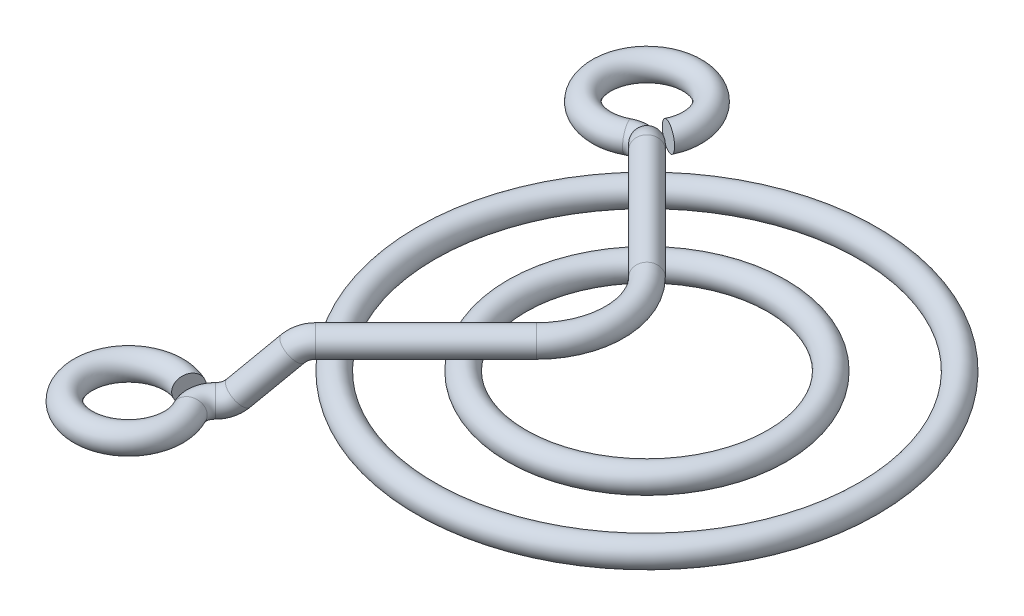
from build123d import *

# Parameters (mm, degrees)
SKETCH1_R               = 0.8
SKETCH3_R               = 0.8
SKETCH5_R               = 0.8
SKETCH7_R               = 0.8
CUT_EXTRUDE1_DEPTH      = 29.131121712
CUT_EXTRUDE1_DEPTH_BACK = 29.131121712
CIRPATTERN1_COUNT       = 2
CIRPATTERN1_ANGLE       = 90
SKETCH10_R              = 0.8


with BuildPart() as part:
    # Sketch1 → Revolve1 (revolve)
    with BuildSketch(Plane.XY):
        with Locations((-8.025, 2.4)):
            Circle(SKETCH1_R)
        with Locations((-13.65, 2.4)):
            Circle(SKETCH1_R)
    revolve(axis=Axis((0, 2.4, 0), (0, -1, 0)))


with BuildPart() as body_2:
    # Sweep1: sweep along a path in Sketch2
    with BuildLine(Plane(origin=(0, 0, 0), x_dir=(1, 0, 0), z_dir=(0, 1, 0))) as sweep1_path:
        Line((-10.224764056, 10.224764056), (-3.414213562, 3.414213562))
        ThreePointArc((-3.414213562, 3.414213562), (-2.36754213, 1.847759065), (-2, 0))
    # Sketch3 → Sweep1 (sweep)
    with BuildSketch(Plane.XY):
        with Locations((-2, 4)):
            Circle(SKETCH3_R)
    sweep(path=sweep1_path.line)

    # Sweep2: sweep along a path in Sketch4
    with BuildLine(Plane(origin=(0, 0, 0), x_dir=(-0.7071067811865488, 0, -0.7071067811865464), z_dir=(0.7071067811865464, -1.0221956111222453e-15, -0.7071067811865488))) as sweep2_path:
        ThreePointArc((14.46, 4), (15.000811939, 3.892349891), (15.459178331, 3.585810578))
        Line((15.459178331, 3.585810578), (17.828238666, 1.214189422))
        ThreePointArc((17.828238666, 1.214189422), (18.286605059, 0.907650109), (18.827416998, 0.8))
    # Sketch5 → Sweep2 (sweep)
    with BuildSketch(Plane(origin=(-10.224764056, 0, -10.224764056), x_dir=(-0.7071067811865516, 0, 0.7071067811865435), z_dir=(-0.7071067811865435, 0, -0.7071067811865516))):
        with Locations((0, 4)):
            Circle(SKETCH5_R)
    sweep(path=sweep2_path.line)

    # Sweep3: sweep along a path in Sketch6
    with BuildLine(Plane(origin=(0, 0, 0), x_dir=(1, 0, 0), z_dir=(0, 1, 0))) as sweep3_path:
        ThreePointArc((-13.312994231, 13.312994231), (-13.969813741, 13.644890227), (-14.695470506, 13.522460334))
        ThreePointArc((-14.695470506, 13.522460334), (-18.019692949, 17.93928863), (-13.47153688, 14.797139139))
    # Sketch7 → Sweep3 (sweep)
    with BuildSketch(Plane(origin=(-13.312994231, 0, -13.312994231), x_dir=(-0.7071067811865515, 2.0261570199408882e-15, 0.7071067811865437), z_dir=(-0.7071067811865437, -2.0261570199409115e-15, -0.7071067811865515))):
        with Locations((0, 0.8)):
            Circle(SKETCH7_R)
    sweep(path=sweep3_path.line)

    # Sketch8 → Cut-Extrude1 (cut, two sides: drawn at the far end of the back side and taken through both)
    with BuildSketch(Plane(origin=(0, 0, 0), x_dir=(1, 0, 0), z_dir=(0, 1, 0)).offset(-CUT_EXTRUDE1_DEPTH_BACK)):
        Polygon((-46.797302543, -39.968875418), (-3.979898987, 2.848528137), (-2.848528137, 3.979898987), (39.968875418, 46.797302543), (125.603682529, -38.837504568), (38.837504568, -125.603682529), align=None)
    extrude(amount=CUT_EXTRUDE1_DEPTH + CUT_EXTRUDE1_DEPTH_BACK, mode=Mode.SUBTRACT)


with BuildPart() as cirpattern1_1:
    # CirPattern1: pattern copy
    add(body_2.part.rotate(Axis((0, 0, 0), (0, 1, 0)), 1 * CIRPATTERN1_ANGLE / (CIRPATTERN1_COUNT - 1)))


with BuildPart() as body_2_1:
    add(body_2.part)

    add(cirpattern1_1.part)  # Sweep4 merges CirPattern1_1
    # Sweep4: sweep along a path in Sketch9
    with BuildLine(Plane(origin=(0, 0, 0), x_dir=(1, 0, 0), z_dir=(0, 1, 0))) as sweep4_path:
        ThreePointArc((-3.414213562, 3.414213562), (-2, 0), (-3.414213562, -3.414213562))
    # Sketch10 → Sweep4 (sweep)
    with BuildSketch(Plane(origin=(-3.414213562, 0, -3.414213562), x_dir=(0.7071067811865474, 0, -0.7071067811865477), z_dir=(0.7071067811865477, 0, 0.7071067811865474))):
        with Locations((0, 4)):
            Circle(SKETCH10_R)
    sweep(path=sweep4_path.line)


solid = Compound([part.part, body_2_1.part])
